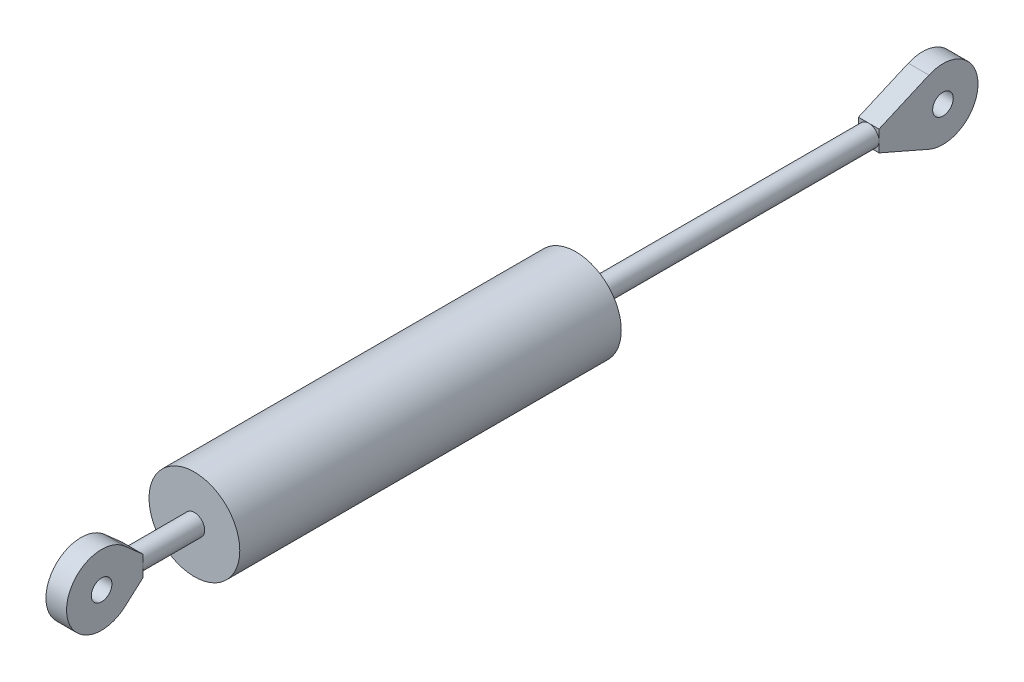
from build123d import *

# Parameters (mm, degrees)
SKETCH1_W                = 92.5
SKETCH1_H                = 11
SKETCH2_R                = 2.5
BOSS_EXTRUDE1_DEPTH      = 15
BOSS_EXTRUDE2_DEPTH      = 2.5
BOSS_EXTRUDE2_DEPTH_BACK = 2.5
SKETCH3_R                = 2.5
BOSS_EXTRUDE3_START      = 71
SKETCH4_R                = 2.5
BOSS_EXTRUDE3_DEPTH      = 71
BOSS_EXTRUDE4_DEPTH      = 2.5
BOSS_EXTRUDE4_DEPTH_BACK = 2.5
SKETCH5_R                = 2.5


with BuildPart() as part:
    # Sketch1 → Revolve1 (revolve)
    with BuildSketch(Plane(origin=(0, 0, 0), x_dir=(0, 0, -1), z_dir=(1, 0, 0))):
        with Locations((0, 5.5)):
            Rectangle(SKETCH1_W, SKETCH1_H)
    revolve(axis=Axis((0, 0, 46.25), (0, 0, -1)))

    # Sketch2 → Boss-Extrude1 (add)
    with BuildSketch(Plane.XY.offset(46.25)):
        Circle(SKETCH2_R)
    extrude(amount=BOSS_EXTRUDE1_DEPTH)

    # Sketch3 → Boss-Extrude2 (add, two sides: drawn at the far end of the back side and taken through both)
    with BuildSketch(Plane(origin=(0, 0, 0), x_dir=(0, 0, -1), z_dir=(1, 0, 0)).offset(-BOSS_EXTRUDE2_DEPTH_BACK)):
        with BuildLine():
            Line((-61.25, 2.5), (-65.616190379, 6.364761516))
            ThreePointArc((-65.616190379, 6.364761516), (-79.75, 0), (-65.616190379, -6.364761516))
            Line((-65.616190379, -6.364761516), (-61.25, -2.5))
            Line((-61.25, -2.5), (-61.25, 2.5))
        make_face()
        with Locations((-71.25, 0)):
            Circle(SKETCH3_R, mode=Mode.SUBTRACT)
    extrude(amount=BOSS_EXTRUDE2_DEPTH + BOSS_EXTRUDE2_DEPTH_BACK)

    # Sketch4 → Boss-Extrude3 (add)
    with BuildSketch(Plane(origin=(0, 0, -46.25), x_dir=(-1, 0, 0), z_dir=(0, 0, -1)).offset(BOSS_EXTRUDE3_START)):
        Circle(SKETCH4_R)
    extrude(amount=-BOSS_EXTRUDE3_DEPTH)

    # Sketch5 → Boss-Extrude4 (add, two sides: drawn at the far end of the back side and taken through both)
    with BuildSketch(Plane(origin=(0, 0, 0), x_dir=(0, 0, -1), z_dir=(1, 0, 0)).offset(-BOSS_EXTRUDE4_DEPTH_BACK)):
        with BuildLine():
            Line((117.25, 2.5), (129.34486024, 7.788133487))
            ThreePointArc((129.34486024, 7.788133487), (141.25, 0), (129.34486024, -7.788133487))
            Line((129.34486024, -7.788133487), (117.25, -2.5))
            Line((117.25, -2.5), (117.25, 2.5))
        make_face()
        with Locations((132.75, 0)):
            Circle(SKETCH5_R, mode=Mode.SUBTRACT)
    extrude(amount=BOSS_EXTRUDE4_DEPTH + BOSS_EXTRUDE4_DEPTH_BACK)


solid = part.part
